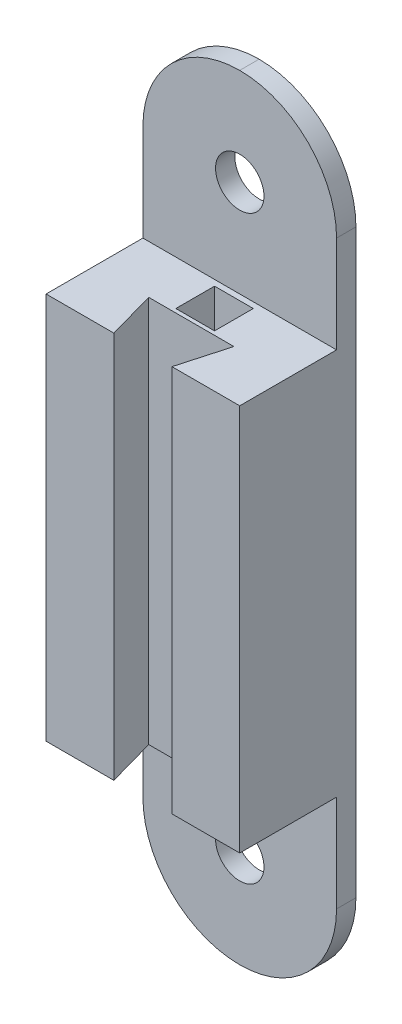
from build123d import *

# Parameters (mm, degrees)
SKETCH1_W           = 25.4
SKETCH1_H           = 25.4
SKETCH1_R           = 3.175
SKETCH1_H_2         = 50.8
BOSS_EXTRUDE1_DEPTH = 2.54
SKETCH1_3_W         = 25.4
SKETCH1_3_H         = 50.8
BOSS_EXTRUDE2_DEPTH = 15.24
CUT_EXTRUDE1_DEPTH  = 79.74
FILLET1_R           = 12.7
SKETCH4_W           = 5.08
SKETCH4_H           = 5.08
CUT_EXTRUDE2_DEPTH  = 20.32


with BuildPart() as part:
    # Sketch1 → Boss-Extrude1 (new body)
    # profile 1 of 3: a face of its own
    with BuildSketch(Plane.XY):
        with Locations((0, 50.8)):
            Rectangle(SKETCH1_W, SKETCH1_H)
        with Locations((0, 50.8)):
            Circle(SKETCH1_R, mode=Mode.SUBTRACT)
    # profile 2 of 3: a face of its own
    with BuildSketch(Plane.XY):
        with Locations((0, 12.7)):
            Rectangle(SKETCH1_W, SKETCH1_H_2)
    # profile 3 of 3: a face of its own
    with BuildSketch(Plane.XY):
        with Locations((0, -25.4)):
            Rectangle(SKETCH1_W, SKETCH1_H)
        with Locations((0, -25.4)):
            Circle(SKETCH1_R, mode=Mode.SUBTRACT)
    extrude(amount=BOSS_EXTRUDE1_DEPTH)

    # Sketch1<3> → Boss-Extrude2 (add)
    with BuildSketch(Plane.XY):
        with Locations((0, 12.7)):
            Rectangle(SKETCH1_3_W, SKETCH1_3_H)
    extrude(amount=BOSS_EXTRUDE2_DEPTH)

    # Sketch3 → Cut-Extrude1 (cut, through all)
    with BuildSketch(Plane(origin=(0, 38.1, 0), x_dir=(1, 0, 0), z_dir=(0, 1, 0))):
        Polygon((-5.588, -8.89), (-3.81, -15.24), (3.81, -15.24), (5.588, -8.89), align=None)
    extrude(amount=-CUT_EXTRUDE1_DEPTH, mode=Mode.SUBTRACT)

    # Fillet1
    fillet1_edges = [part.edges().sort_by_distance(p)[0] for p in [
        (12.7, -38.1, 1.27),
        (-12.7, -38.1, 1.27),
        (12.7, 63.5, 1.27),
        (-12.7, 63.5, 1.27),
    ]]
    fillet(fillet1_edges, radius=FILLET1_R - 0.0001)  # a hair under: the kernel refuses the full size

    # Sketch4 → Cut-Extrude2 (cut)
    with BuildSketch(Plane(origin=(0, 38.1, 0), x_dir=(1, 0, 0), z_dir=(0, 1, 0))):
        with Locations((0, -5.842)):
            Rectangle(SKETCH4_W, SKETCH4_H)
    extrude(amount=-CUT_EXTRUDE2_DEPTH, mode=Mode.SUBTRACT)


solid = part.part
